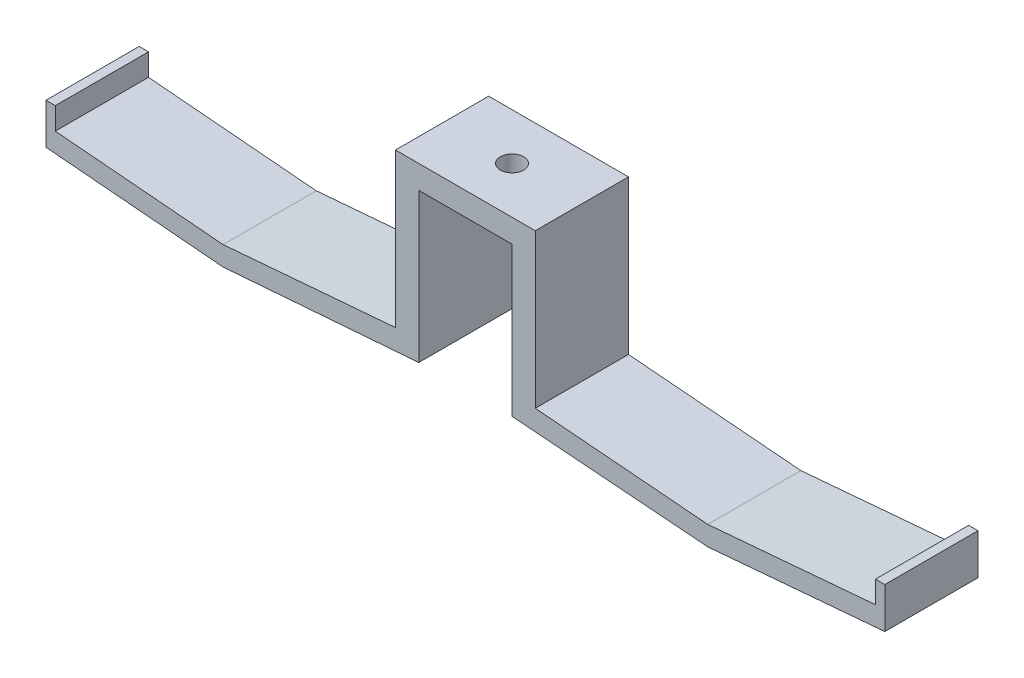
from build123d import *

# Parameters (mm, degrees)
BOSS_EXTRUDE1_DEPTH = 25.4
CUT_EXTRUDE1_REACH  = 129.762
SKETCH3_R           = 3.175


with BuildPart() as part:
    # Sketch2 → Boss-Extrude1 (new body)
    with BuildSketch(Plane.XY):
        Polygon((12.7, 0), (12.7, -40.64), (66.04, -44.773379719), (114.3, -40.64), (114.3, -29.533379719), (111.76, -29.533379719), (111.76, -35.56), (66.04, -39.475833418), (19.05, -35.56), (19.05, 6.35), (-19.05, 6.35), (-19.05, -35.56), (-66.04, -39.475833418), (-111.76, -35.56), (-111.76, -29.533379719), (-114.3, -29.533379719), (-114.3, -40.64), (-66.04, -44.773379719), (-12.7, -40.64), (-12.7, 0), align=None)
    extrude(amount=BOSS_EXTRUDE1_DEPTH)

    # Sketch3 → Cut-Extrude1 (cut, up to next)
    with BuildSketch(Plane(origin=(0, 6.35, 0), x_dir=(1, 0, 0), z_dir=(0, 1, 0)), mode=Mode.PRIVATE) as cut_extrude1_sk1:
        with Locations((0, -12.7)):
            Circle(SKETCH3_R)
    cut_extrude1_tool1 = extrude(cut_extrude1_sk1.sketch, amount=-CUT_EXTRUDE1_REACH, mode=Mode.PRIVATE) & part.part
    add(cut_extrude1_tool1.solids().sort_by_distance((0, 6.35, 12.7))[0], mode=Mode.SUBTRACT)


solid = part.part
